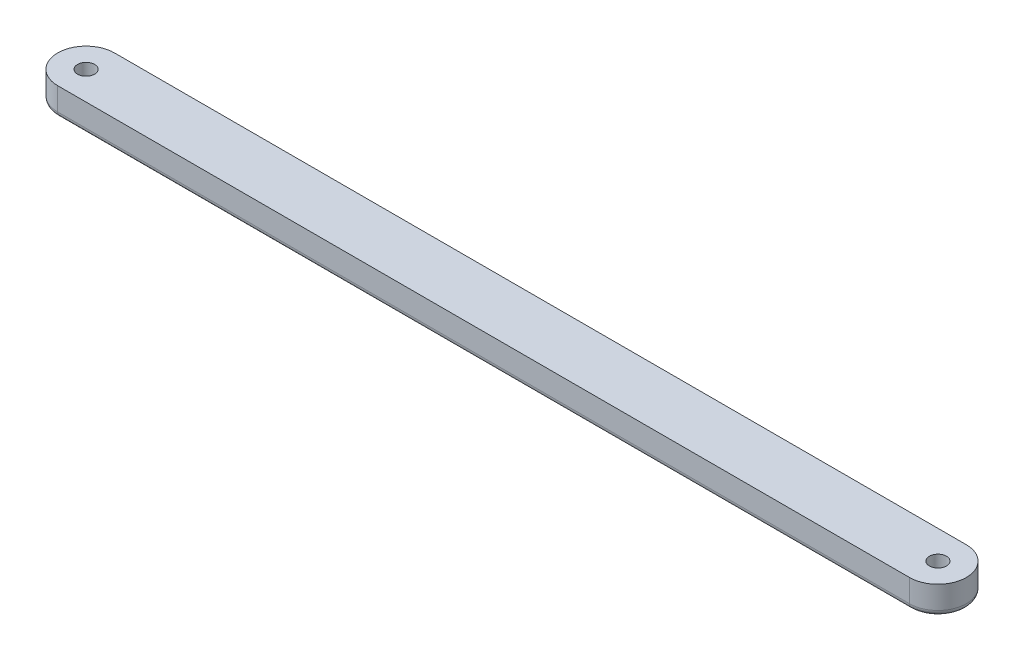
from build123d import *

# Parameters (mm, degrees)
SKETCH1_R           = 1.5
BOSS_EXTRUDE1_DEPTH = 5
FILLET1_R           = 1


with BuildPart() as part:
    # Sketch1 → Boss-Extrude1 (new body)
    with BuildSketch(Plane(origin=(0, 0, 0), x_dir=(1, 0, 0), z_dir=(0, 1, 0))):
        with BuildLine():
            Line((150, 5), (0, 5))
            ThreePointArc((0, 5), (-5, 0), (0, -5))
            Line((0, -5), (150, -5))
            ThreePointArc((150, -5), (155, 0), (150, 5))
        make_face()
        with Locations((150, 0)):
            Circle(SKETCH1_R, mode=Mode.SUBTRACT)
        Circle(SKETCH1_R, mode=Mode.SUBTRACT)
    extrude(amount=BOSS_EXTRUDE1_DEPTH)

    # Fillet1
    fillet1_edges = [part.edges().sort_by_distance(p)[0] for p in [
        (155, 0, 0),
        (75, 0, -5),
        (-5, 0, 0),
        (75, 0, 5),
    ]]
    fillet(fillet1_edges, radius=FILLET1_R)


solid = part.part
